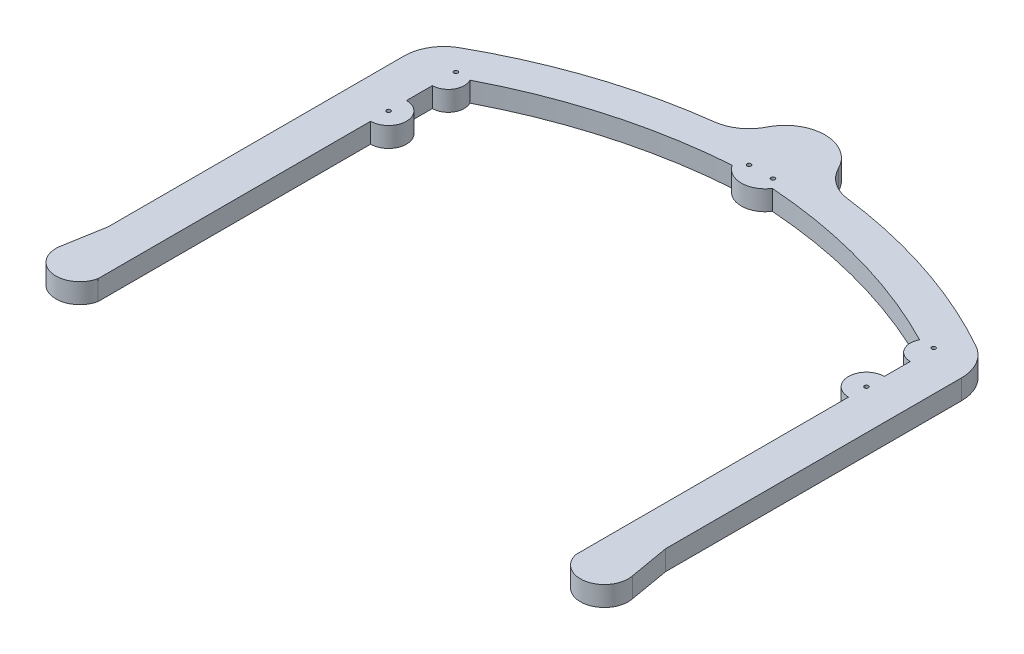
from build123d import *
from build123d.topology import SkipClean

# Parameters (mm, degrees)
BOSS_EXTRUDE2_DEPTH      = 5
FILLET2_R                = 10
BOSS_EXTRUDE3_START      = -5
BOSS_EXTRUDE3_DEPTH      = 5
F_1_0_1_DIAMETER_HOLE1_D = 1
FILLET2_OF_MIRROR2_R     = 10


with BuildPart() as part:
    # Sketch1 → Boss-Extrude2 (new body)
    with BuildSketch(Plane(origin=(0, 0, 0), x_dir=(1, 0, 0), z_dir=(0, 1, 0))):
        with BuildLine():
            Line((70, 17.26770211), (70, 97.26770211))
            ThreePointArc((70, 97.26770211), (41.182242864, 110.705277411), (9.992877492, 116.890343619))
            ThreePointArc((9.992877492, 116.890343619), (7.203248743, 124.204070579), (0, 127.26770211))
            Line((0, 127.26770211), (0, 109.26770211))
            ThreePointArc((0, 109.26770211), (30.987642818, 104.549958577), (60, 92.685126415))
            Line((60, 92.685126415), (60, 4.73229789))
            ThreePointArc((60, 4.73229789), (67.132250802, 0.135451308), (71.729097384, 7.26770211))
            Line((71.729097384, 7.26770211), (70, 17.26770211))
        make_face()
    boss_extrude2 = extrude(amount=BOSS_EXTRUDE2_DEPTH)

    # Fillet2
    fillet2_edges = [part.edges().sort_by_distance(p)[0] for p in [
        (70, 2.5, -97.26770211),
        (9.992877492, 2.5, -116.890343619),
    ]]
    fillet(fillet2_edges, radius=FILLET2_R)

    # Sketch2 → Boss-Extrude3 (add)
    with BuildSketch(Plane(origin=(0, 5, 0), x_dir=(1, 0, 0), z_dir=(0, 1, 0)).offset(BOSS_EXTRUDE3_START)):
        with BuildLine():
            Line((60, 73.185126415), (60, 82.185126415))
            ThreePointArc((60, 82.185126415), (55.5, 77.685126415), (60, 73.185126415))
        make_face()
        with BuildLine():
            ThreePointArc((60, 92.685126415), (58.244034428, 93.642629822), (56.473816025, 94.573519004))
            ThreePointArc((56.473816025, 94.573519004), (56.568267904, 90.63008023), (60, 88.685126415))
            Line((60, 88.685126415), (60, 92.685126415))
        make_face()
        with BuildLine():
            Line((0, 109.26770211), (0, 106.26770211))
            ThreePointArc((0, 106.26770211), (2.867080942, 106.997043055), (5.037135375, 109.007753151))
            ThreePointArc((5.037135375, 109.007753151), (2.519804725, 109.161698195), (0, 109.26770211))
        make_face()
    boss_extrude3 = extrude(amount=BOSS_EXTRUDE3_DEPTH)

    # Ø1.0 (1) Diameter Hole1 (through all)
    with Locations(Plane(origin=(0, 5, 0), x_dir=(1, 0, 0), z_dir=(0, 1, 0))):
        with Locations((60, 77.685126415), (60, 94.573519004), (3, 111.210042747)):
            f_1_0_1_diameter_hole1 = Hole(F_1_0_1_DIAMETER_HOLE1_D / 2)

    # Mirror2: Boss-Extrude2, Boss-Extrude3, Ø1.0 (1) Diameter Hole1 across plane
    with SkipClean():  # the faces are left unmerged after this step: merging them gives an invalid solid
        add(boss_extrude2.mirror(Plane(origin=(0, 5, 0), x_dir=(0, 0, 1), z_dir=(1, 0, 0))))
        add(boss_extrude3.mirror(Plane(origin=(0, 5, 0), x_dir=(0, 0, 1), z_dir=(1, 0, 0))))
        add(f_1_0_1_diameter_hole1.mirror(Plane(origin=(0, 5, 0), x_dir=(0, 0, 1), z_dir=(1, 0, 0))), mode=Mode.SUBTRACT)

    # Fillet2 of Mirror2
    fillet2_of_mirror2_edges = [part.edges().sort_by_distance(p)[0] for p in [
        (-70, 2.5, -97.26770211),
        (-9.992877492, 2.5, -116.890343619),
    ]]
    fillet(fillet2_of_mirror2_edges, radius=FILLET2_OF_MIRROR2_R)


solid = part.part
